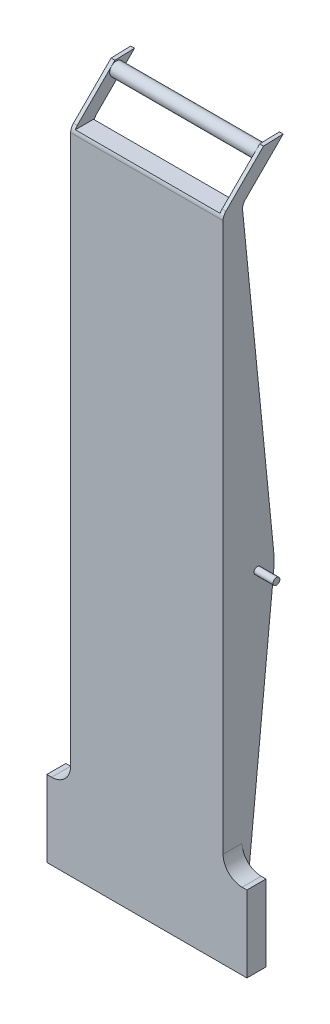
from build123d import *

# Parameters (mm, degrees)
BOSS_EXTRUDE1_DEPTH      = 10
BOSS_EXTRUDE2_DEPTH      = 10
BOSS_EXTRUDE2_DEPTH_BACK = 90
SKETCH2_R                = 1.776294634
BOSS_EXTRUDE3_DEPTH      = 80
FILLET1_R                = 50
BOSS_EXTRUDE6_DEPTH      = 2
BOSS_EXTRUDE7_DEPTH      = 2
SKETCH7_R                = 3.5
BOSS_EXTRUDE8_DEPTH      = 80
FILLET2_START            = -41
FILLET2_DEPTH            = 82
FILLET3_R                = 5
FILLET4_R                = 5


with BuildPart() as part:
    # Sketch1 → Boss-Extrude1 (new body)
    with BuildSketch(Plane.XY):
        with BuildLine():
            Line((50, -150), (52.5, -150))
            Line((52.5, -150), (52.5, -190))
            Line((52.5, -190), (-52.5, -190))
            Line((-52.5, -190), (-52.5, -150))
            Line((-52.5, -150), (-50, -150))
            ThreePointArc((-50, -150), (-42.928932188, -147.071067812), (-40, -140))
            Line((-40, -140), (-40, 150))
            Line((-40, 150), (40, 150))
            Line((40, 150), (40, -140))
            ThreePointArc((40, -140), (42.928932188, -147.071067812), (50, -150))
        make_face()
    extrude(amount=BOSS_EXTRUDE1_DEPTH)

    # Sketch3 → Boss-Extrude3 (add)
    with BuildSketch(Plane(origin=(40, 0, 0), x_dir=(0, 0, -1), z_dir=(1, 0, 0))):
        Polygon((0, 150), (17, -20), (0, -190), align=None)
    extrude(amount=-BOSS_EXTRUDE3_DEPTH)

    # Fillet1
    fillet1_edges = [part.edges().sort_by_distance(p)[0] for p in [
        (0, -20, -17),
    ]]
    fillet(fillet1_edges, radius=FILLET1_R)

    # Sketch6 → Boss-Extrude7 (add)
    with BuildSketch(Plane.ZY.offset(40)):
        Polygon((10, 150), (0, 150), (-21.533549548, 171.533549548), (-11.213203436, 171.213203436), align=None)
    extrude(amount=-BOSS_EXTRUDE7_DEPTH)



with BuildPart() as body_2:
    # Sketch2 → Boss-Extrude2 (new, two sides: drawn at the far end of the back side and taken through both)
    with BuildSketch(Plane(origin=(40, 0, 0), x_dir=(0, 0, -1), z_dir=(1, 0, 0)).offset(-BOSS_EXTRUDE2_DEPTH_BACK)):
        with Locations(Location((8, -20, 0), (0, 0, 90))):
            Circle(SKETCH2_R)
    extrude(amount=BOSS_EXTRUDE2_DEPTH + BOSS_EXTRUDE2_DEPTH_BACK)


with BuildPart() as body_3:
    # Sketch5 → Boss-Extrude6 (new body)
    with BuildSketch(Plane(origin=(40, 0, 0), x_dir=(0, 0, -1), z_dir=(1, 0, 0))):
        Polygon((0, 150), (-10, 150), (11.213203436, 171.213203436), (21.533549548, 171.533549548), align=None)
    extrude(amount=-BOSS_EXTRUDE6_DEPTH)


with BuildPart() as part_1:
    add(part.part)

    add(body_3.part)  # Boss-Extrude8 merges body 3
    # Sketch7 → Boss-Extrude8 (add)
    with BuildSketch(Plane.ZY.offset(40)):
        with Locations(Location((-11.999244943, 167, 0), (0, 0, 180))):
            Circle(SKETCH7_R)
    extrude(amount=-BOSS_EXTRUDE8_DEPTH)

    # Fillet2: read off the stored shape, not the designer's step
    # Fillet2 outline → Fillet2 (cut)
    with BuildSketch(Plane.YZ.offset(FILLET2_START)):
        with BuildLine():
            Line((150, 10), (147.928932188, 10))
            ThreePointArc((147.928932188, 10), (149.84234935, 9.619397663), (151.464466094, 8.535533906))
            Line((151.464466094, 8.535533906), (150, 10))
        make_face()
    extrude(amount=FILLET2_DEPTH, mode=Mode.SUBTRACT)

    # Fillet3
    fillet3_edges = [part_1.edges().sort_by_distance(p)[0] for p in [
        (39, 150, 0),
    ]]
    fillet(fillet3_edges, radius=FILLET3_R)

    # Fillet4
    fillet4_edges = [part_1.edges().sort_by_distance(p)[0] for p in [
        (-39, 150, 0),
    ]]
    fillet(fillet4_edges, radius=FILLET4_R)


solid = Compound([body_2.part, part_1.part])
